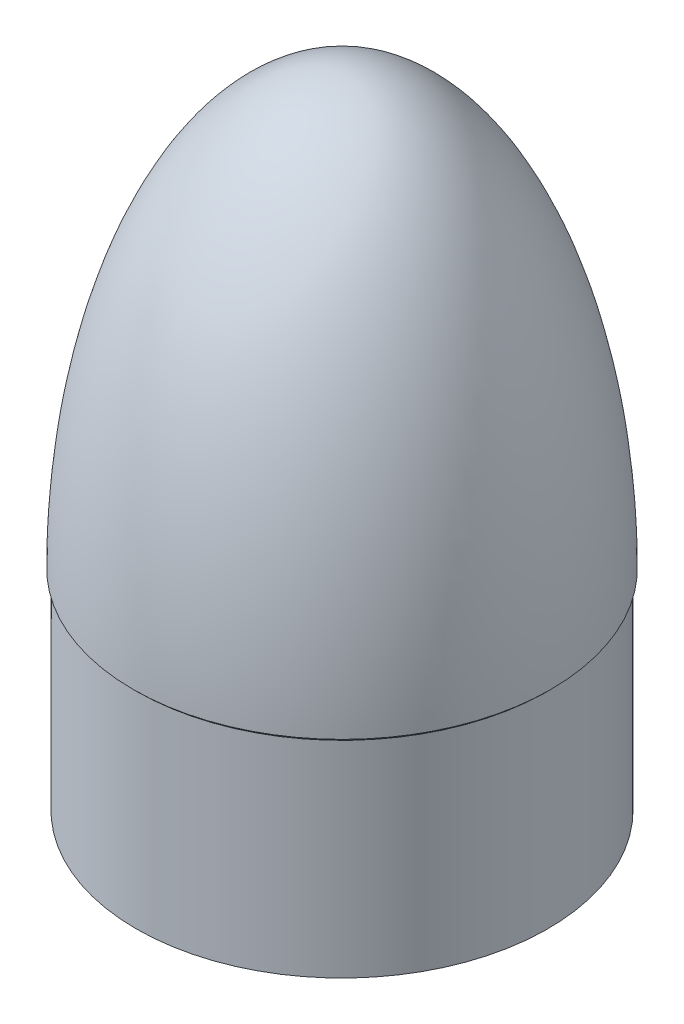
from build123d import *


with BuildPart() as part:
    # Sketch1 → Revolve1 (revolve)
    with BuildSketch(Plane.XY):
        with BuildLine():
            Line((0, 165.1), (0, 162.1028))
            add(Edge.make_bspline(
                [(76.3778, 0), (76.3778, 162.1028), (0, 162.1028)],
                knots=[4.71238898, 4.71238898, 4.71238898, 6.283185307, 6.283185307, 6.283185307], degree=2, weights=[1, 0.707106781, 1]))
            Line((76.3778, 0), (76.3778, -80.518))
            Line((76.3778, -80.518), (79.375, -80.518))
            Line((79.375, -80.518), (79.375, -1.143))
            Line((79.375, -1.143), (80.518, 0))
            add(Edge.make_bspline(
                [(80.518, 0), (80.518, 165.1), (0, 165.1)],
                knots=[1.570796327, 1.570796327, 1.570796327, 3.141592654, 3.141592654, 3.141592654], degree=2, weights=[1, 0.707106781, 1]))
        make_face()
    revolve(axis=Axis((0, 165.1, 0), (0, -1, 0)))


solid = part.part
